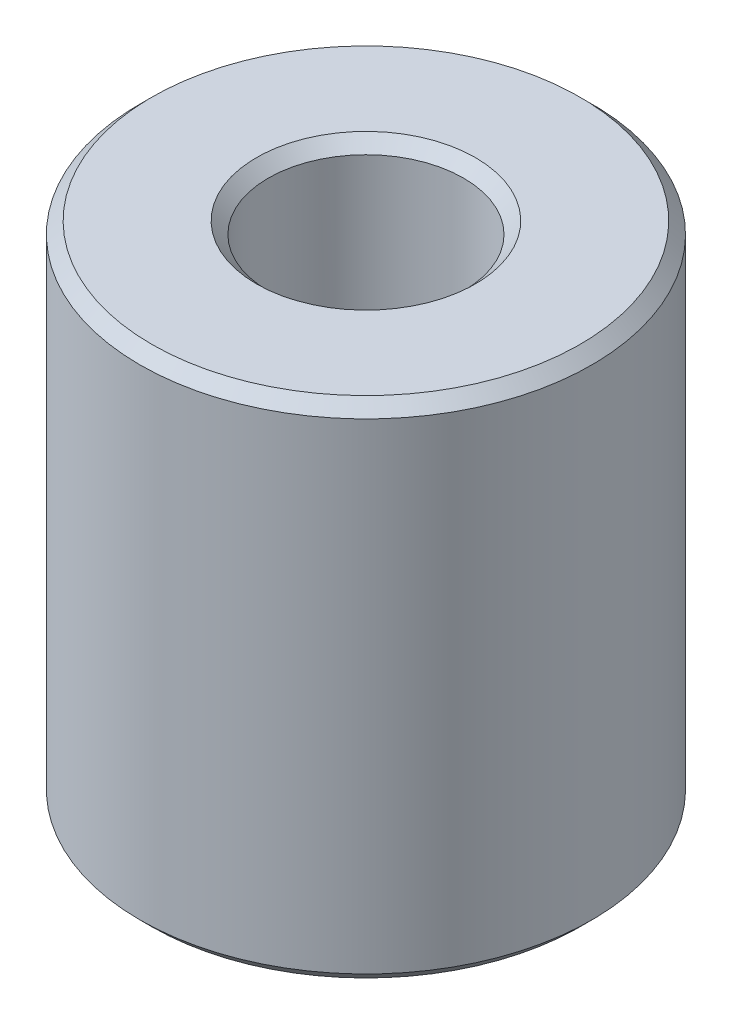
from build123d import *

# Parameters (mm, degrees)
SKETCH1_R           = 15
BOSS_EXTRUDE1_DEPTH = 33.479991586
SKETCH2_R           = 6.481585587
CUT_EXTRUDE1_DEPTH  = 40.634704951
CHAMFER1_SIZE       = 0.785728698


with BuildPart() as part:
    # Sketch1 → Boss-Extrude1 (new body)
    with BuildSketch(Plane(origin=(0, 0, 0), x_dir=(1, 0, 0), z_dir=(0, 1, 0))):
        Circle(SKETCH1_R)
    extrude(amount=BOSS_EXTRUDE1_DEPTH)

    # Sketch2 → Cut-Extrude1 (cut, through all)
    with BuildSketch(Plane(origin=(0, 0, 0), x_dir=(1, 0, 0), z_dir=(0, 1, 0))):
        Circle(SKETCH2_R)
    extrude(amount=CUT_EXTRUDE1_DEPTH, mode=Mode.SUBTRACT)

    # Chamfer1
    chamfer1_edges = [part.edges().sort_by_distance(p)[0] for p in [
        (-6.481585587, 33.479991586, 0),
        (-6.481585587, 0, 0),
        (-15, 0, 0),
        (-15, 33.479991586, 0),
    ]]
    chamfer(chamfer1_edges, length=CHAMFER1_SIZE)


solid = part.part
